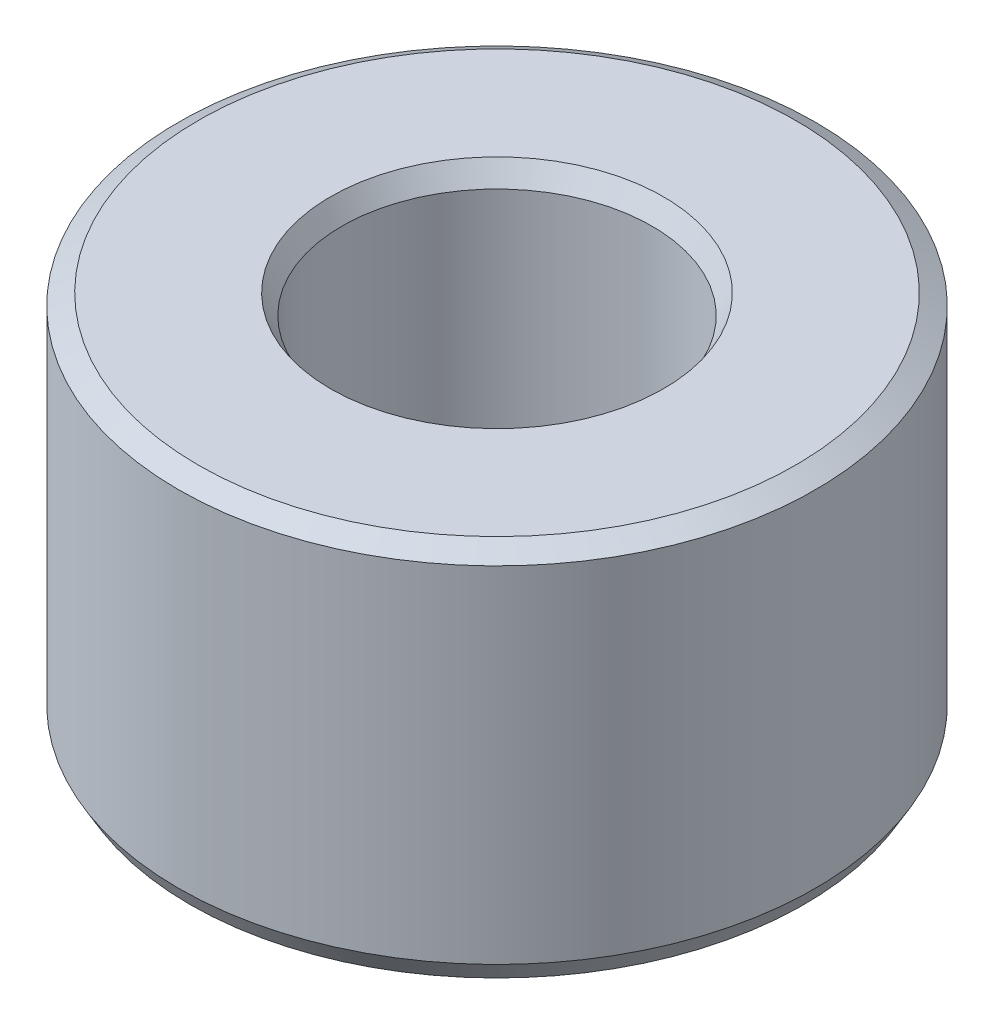
from build123d import *
from OCP.BRepFilletAPI import BRepFilletAPI_MakeChamfer

# Parameters (mm, degrees)
SKETCH1_R           = 37.5
BOSS_EXTRUDE1_DEPTH = 44.325740123
SKETCH2_R           = 18.25948724
CUT_EXTRUDE1_DEPTH  = 70.117806949
CHAMFER1_SIZE       = 1.344779719
CHAMFER1_SIZE2      = 2.329226797


with BuildPart() as part:
    # Sketch1 → Boss-Extrude1 (new body)
    with BuildSketch(Plane(origin=(0, 0, 0), x_dir=(1, 0, 0), z_dir=(0, 1, 0))):
        Circle(SKETCH1_R)
    extrude(amount=BOSS_EXTRUDE1_DEPTH)

    # Sketch2 → Cut-Extrude1 (cut, through all)
    with BuildSketch(Plane(origin=(0, 0, 0), x_dir=(1, 0, 0), z_dir=(0, 1, 0))):
        Circle(SKETCH2_R)
    extrude(amount=CUT_EXTRUDE1_DEPTH, mode=Mode.SUBTRACT)

    # Chamfer1: one chamfer whose edges measure the first distance from different faces: ONE call of the kernel's chamfer builder (chamfer() names one face for all edges)
    chamfer1_edges_1 = [part.edges().sort_by_distance(p)[0] for p in [
        (-18.25948724, 44.325740123, 0),
    ]]
    chamfer1_side_1 = [part.faces().sort_by_distance(p)[0] for p in [
        (-36.439339828, 44.325740123, 0),
    ]]
    chamfer1_edges_2 = [part.edges().sort_by_distance(p)[0] for p in [
        (-18.25948724, 0, 0),
    ]]
    chamfer1_side_2 = [part.faces().sort_by_distance(p)[0] for p in [
        (-18.25948724, 22.162870062, 0),
    ]]
    chamfer1_edges_3 = [part.edges().sort_by_distance(p)[0] for p in [
        (-37.5, 0, 0),
    ]]
    chamfer1_side_3 = [part.faces().sort_by_distance(p)[0] for p in [
        (-36.439339828, 0, 0),
    ]]
    chamfer1_edges_4 = [part.edges().sort_by_distance(p)[0] for p in [
        (-37.5, 44.325740123, 0),
    ]]
    chamfer1_side_4 = [part.faces().sort_by_distance(p)[0] for p in [
        (-37.5, 22.162870062, 0),
    ]]
    chamfer1 = BRepFilletAPI_MakeChamfer(part.part.solid().wrapped)
    for e in chamfer1_edges_1:
        chamfer1.Add(CHAMFER1_SIZE, CHAMFER1_SIZE2, e.wrapped, chamfer1_side_1[0].wrapped)  # the first distance lies on this face
    for e in chamfer1_edges_2:
        chamfer1.Add(CHAMFER1_SIZE, CHAMFER1_SIZE2, e.wrapped, chamfer1_side_2[0].wrapped)  # the first distance lies on this face
    for e in chamfer1_edges_3:
        chamfer1.Add(CHAMFER1_SIZE, CHAMFER1_SIZE2, e.wrapped, chamfer1_side_3[0].wrapped)  # the first distance lies on this face
    for e in chamfer1_edges_4:
        chamfer1.Add(CHAMFER1_SIZE, CHAMFER1_SIZE2, e.wrapped, chamfer1_side_4[0].wrapped)  # the first distance lies on this face
    add(Compound.cast(chamfer1.Shape()), mode=Mode.REPLACE)


solid = part.part
